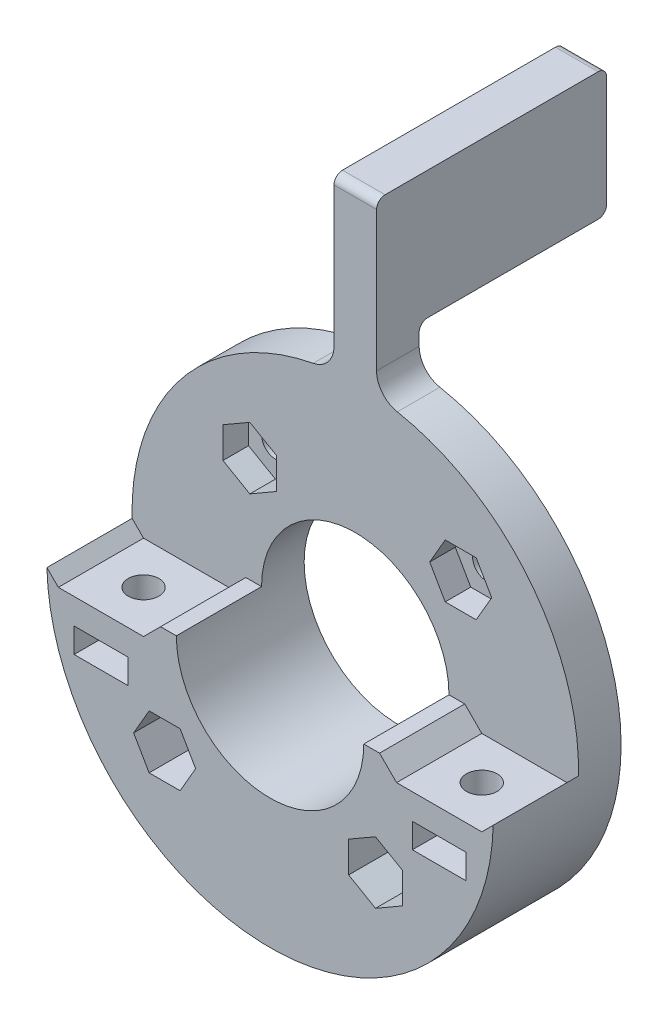
from build123d import *

# Parameters (mm, degrees)
ESBO_O1_R                = 28.7
RESSALTO_EXTRUS_O1_DEPTH = 5
ESBO_O2_R                = 11
CORTE_EXTRUS_O1_DEPTH    = 8
ESBO_O3_R                = 7.5
CORTE_EXTRUS_O2_DEPTH    = 42.801674608
RESSALTO_EXTRUS_O4_START = 10
RESSALTO_EXTRUS_O4_DEPTH = 10
ESBO_O9_W                = 10
ESBO_O9_H                = 2
CORTE_EXTRUS_O5_DEPTH    = 10
CHANFRO1_SIZE            = 2
ESBO_O10_R               = 1.8
CORTE_EXTRUS_O6_DEPTH    = 10
CORTE_EXTRUS_O7_START    = -3
CORTE_EXTRUS_O7_DEPTH    = 2.9
CORTE_EXTRUS_O8_START    = -5
ESBO_O13_R               = 28.7
CORTE_EXTRUS_O8_DEPTH    = 5
ESBO_O14_R               = 28.7
ESBO_O14_R_2             = 26.2
CORTE_EXTRUS_O9_DEPTH    = 44.271006459
ESBO_O15_R               = 1.6
CORTE_EXTRUS_O10_DEPTH   = 40.973491216
CORTE_EXTRUS_O11_START   = -3
CORTE_EXTRUS_O11_DEPTH   = 42.378118766
RESSALTO_EXTRUS_O5_START = -5
RESSALTO_EXTRUS_O5_DEPTH = 5
ESBO_O19_W               = 22
ESBO_O19_H               = 15
RESSALTO_EXTRUS_O6_DEPTH = 5
FILETE1_R                = 3
FILETE2_R                = 1
FILETE3_R                = 1


with BuildPart() as part:
    # Esboço1 → Ressalto-extrusão1 (new, symmetric)
    with BuildSketch(Plane.XY):
        Circle(ESBO_O1_R)
    extrude(amount=RESSALTO_EXTRUS_O1_DEPTH, both=True)

    # Esboço2 → Corte-extrusão1 (cut)
    with BuildSketch(Plane.XY.offset(5)):
        Circle(ESBO_O2_R)
    extrude(amount=-CORTE_EXTRUS_O1_DEPTH, mode=Mode.SUBTRACT)

    # Esboço3 → Corte-extrusão2 (cut, through all)
    with BuildSketch(Plane(origin=(0, 0, -5), x_dir=(-1, 0, 0), z_dir=(0, 0, -1))):
        Circle(ESBO_O3_R)
    extrude(amount=-CORTE_EXTRUS_O2_DEPTH, mode=Mode.SUBTRACT)

    # Esboço8 → Ressalto-extrusão4 (add)
    with BuildSketch(Plane.XY.offset(5).offset(RESSALTO_EXTRUS_O4_START)):
        with BuildLine():
            Line((-11, 0), (-28.7, 0))
            ThreePointArc((-28.7, 0), (0, -28.7), (28.7, 0))
            Line((28.7, 0), (11, 0))
            ThreePointArc((11, 0), (0, -11), (-11, 0))
        make_face()
    extrude(amount=-RESSALTO_EXTRUS_O4_DEPTH)

    # Esboço9 → Corte-extrusão5 (cut)
    with BuildSketch(Plane.XY.offset(15)):
        with Locations((-19.85, -1)):
            Rectangle(ESBO_O9_W, ESBO_O9_H)
        with Locations((19.85, -1)):
            Rectangle(ESBO_O9_W, ESBO_O9_H)
    extrude(amount=-CORTE_EXTRUS_O5_DEPTH, mode=Mode.SUBTRACT)

    # Chanfro1
    chanfro1_edges = [part.edges().sort_by_distance(p)[0] for p in [
        (24.85, 0, 10),
        (14.85, 0, 10),
        (-14.85, 0, 10),
        (-24.85, 0, 10),
    ]]
    chamfer(chanfro1_edges, length=CHANFRO1_SIZE - 0.0001)  # a hair under: the kernel refuses the full size

    # Esboço10 → Corte-extrusão6 (cut)
    with BuildSketch(Plane(origin=(0, -2, 0), x_dir=(1, 0, 0), z_dir=(0, 1, 0))):
        with Locations(Location((-19.85, -10, 0), (0, 0, 180))):
            Circle(ESBO_O10_R)
        with Locations((19.85, -10)):
            Circle(ESBO_O10_R)
    extrude(amount=-CORTE_EXTRUS_O6_DEPTH, mode=Mode.SUBTRACT)

    # Esboço11 → Corte-extrusão7 (cut)
    with BuildSketch(Plane(origin=(0, -2, 0), x_dir=(1, 0, 0), z_dir=(0, 1, 0)).offset(CORTE_EXTRUS_O7_START)):
        Polygon((-23, -8.181346652), (-23, -11.818653348), (-23, -15), (-16.7, -15), (-16.7, -11.818653348), (-16.7, -8.181346652), (-19.85, -6.362693304), align=None)
        Polygon((23, -15), (23, -11.818653348), (23, -8.181346652), (19.85, -6.362693304), (16.7, -8.181346652), (16.7, -11.818653348), (16.7, -15), align=None)
    extrude(amount=-CORTE_EXTRUS_O7_DEPTH, mode=Mode.SUBTRACT)

    # Esboço13 → Corte-extrusão8 (cut)
    with BuildSketch(Plane(origin=(0, 0, -5), x_dir=(-1, 0, 0), z_dir=(0, 0, -1)).offset(CORTE_EXTRUS_O8_START)):
        Circle(ESBO_O13_R)
    extrude(amount=CORTE_EXTRUS_O8_DEPTH, mode=Mode.SUBTRACT)

    # Esboço14 → Corte-extrusão9 (cut, through all)
    with BuildSketch(Plane(origin=(0, 0, 0), x_dir=(-1, 0, 0), z_dir=(0, 0, -1))):
        Circle(ESBO_O14_R)
        Circle(ESBO_O14_R_2, mode=Mode.SUBTRACT)
    extrude(amount=-CORTE_EXTRUS_O9_DEPTH, mode=Mode.SUBTRACT)

    # Esboço15 → Corte-extrusão10 (cut, through all)
    with BuildSketch(Plane(origin=(0, 0, 0), x_dir=(-1, 0, 0), z_dir=(0, 0, -1))):
        with Locations((-12.374368671, 12.374368671)):
            Circle(ESBO_O15_R)
        with Locations((12.374368671, 12.374368671)):
            Circle(ESBO_O15_R)
        with Locations((12.374368671, -12.374368671)):
            Circle(ESBO_O15_R)
        with Locations((-12.374368671, -12.374368671)):
            Circle(ESBO_O15_R)
    extrude(amount=-CORTE_EXTRUS_O10_DEPTH, mode=Mode.SUBTRACT)

    # Esboço17 → Corte-extrusão11 (cut, through all)
    with BuildSketch(Plane.XY.offset(5).offset(CORTE_EXTRUS_O11_START)):
        Polygon((-15.524368671, 14.193022019), (-15.524368671, 10.555715323), (-12.374368671, 8.737061975), (-9.224368671, 10.555715323), (-9.224368671, 14.193022019), (-12.374368671, 16.011675367), align=None)
        Polygon((16.011675367, 12.374368671), (14.193022019, 15.524368671), (10.555715323, 15.524368671), (8.737061975, 12.374368671), (10.555715323, 9.224368671), (14.193022019, 9.224368671), align=None)
        Polygon((12.374368671, -16.011675367), (15.524368671, -14.193022019), (15.524368671, -10.555715323), (12.374368671, -8.737061975), (9.224368671, -10.555715323), (9.224368671, -14.193022019), align=None)
        Polygon((-16.011675367, -12.374368671), (-14.193022019, -15.524368671), (-10.555715323, -15.524368671), (-8.737061975, -12.374368671), (-10.555715323, -9.224368671), (-14.193022019, -9.224368671), align=None)
    extrude(amount=CORTE_EXTRUS_O11_DEPTH, mode=Mode.SUBTRACT)

    # Esboço18 → Ressalto-extrusão5 (add)
    with BuildSketch(Plane.XY.offset(5).offset(RESSALTO_EXTRUS_O5_START)):
        with BuildLine():
            Line((-2.5, 26.08045245), (-2.5, 46.08045245))
            Line((-2.5, 46.08045245), (2.5, 46.08045245))
            Line((2.5, 46.08045245), (2.5, 26.08045245))
            ThreePointArc((2.5, 26.08045245), (0, 26.2), (-2.5, 26.08045245))
        make_face()
    extrude(amount=RESSALTO_EXTRUS_O5_DEPTH)

    # Esboço19 → Ressalto-extrusão6 (add)
    with BuildSketch(Plane(origin=(2.5, 0, 0), x_dir=(0, 0, -1), z_dir=(1, 0, 0))):
        with Locations((11, 38.58045245)):
            Rectangle(ESBO_O19_W, ESBO_O19_H)
    extrude(amount=-RESSALTO_EXTRUS_O6_DEPTH)

    # Filete1
    filete1_edges = [part.edges().sort_by_distance(p)[0] for p in [
        (2.5, 26.08045245, 2.5),
        (-2.5, 26.08045245, 2.5),
    ]]
    fillet(filete1_edges, radius=FILETE1_R)

    # Filete2
    filete2_edges = [part.edges().sort_by_distance(p)[0] for p in [
        (0, 31.08045245, 0),
    ]]
    fillet(filete2_edges, radius=FILETE2_R)

    # Filete3
    filete3_edges = [part.edges().sort_by_distance(p)[0] for p in [
        (0, 46.08045245, 5),
        (0, 46.08045245, -22),
        (0, 31.08045245, -22),
    ]]
    fillet(filete3_edges, radius=FILETE3_R)


solid = part.part
